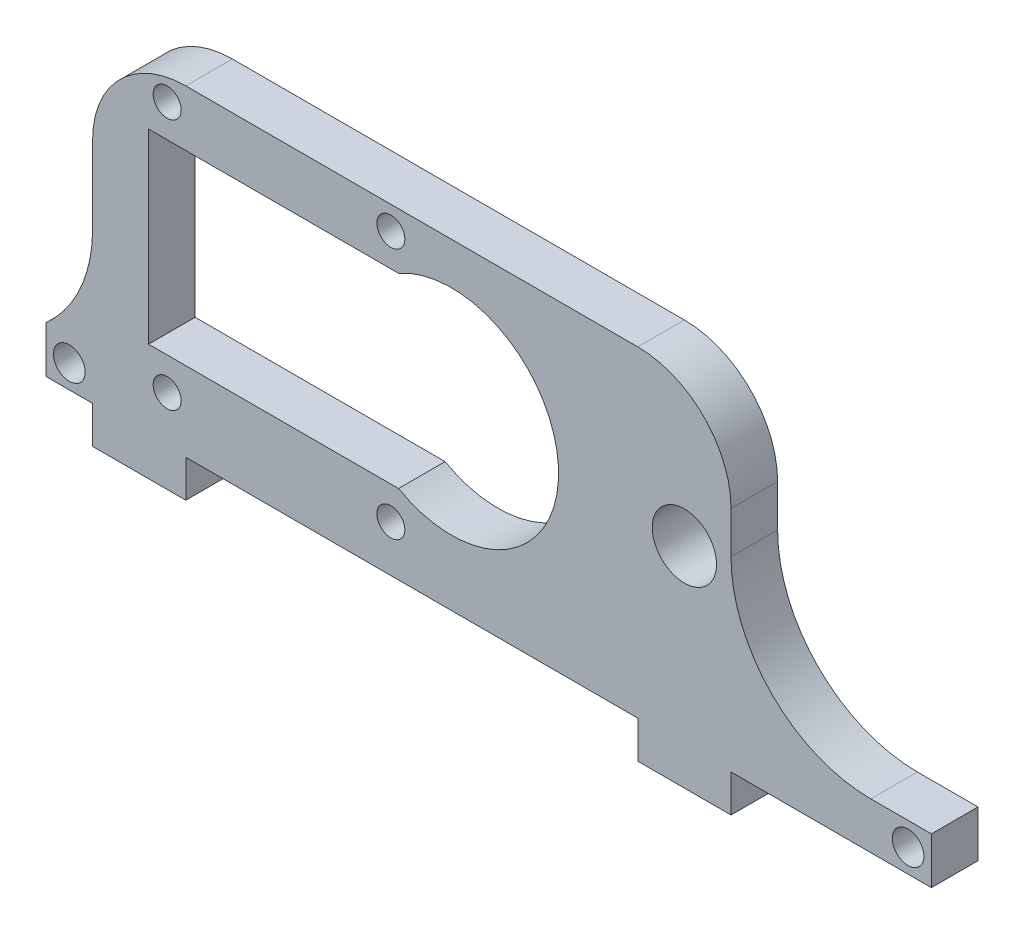
from build123d import *

# Parameters (mm, degrees)
SKETCH1_R          = 3.45
SKETCH1_R_2        = 1.5
SKETCH1_R_3        = 1.7
BASE_FLANGE1_DEPTH = 5
FILLET1_R          = 15
FILLET2_R          = 15


# Sheet-metal steps are written as plain solids
with BuildPart() as part:
    # Sketch1 → Base-Flange1 (new body)
    with BuildSketch(Plane.XY):
        with BuildLine():
            Line((-28.5, 16), (20, 16))
            ThreePointArc((20, 16), (27.071067812, 13.071067812), (30, 6))
            Line((30, 6), (30, -13.5))
            Line((30, -13.5), (51.5, -13.5))
            Line((51.5, -13.5), (51.5, -18.5))
            Line((51.5, -18.5), (30, -18.5))
            Line((30, -18.5), (30, -22.5))
            Line((30, -22.5), (20, -22.5))
            Line((20, -22.5), (20, -18.5))
            Line((20, -18.5), (-28.5, -18.5))
            Line((-28.5, -18.5), (-28.5, -22.5))
            Line((-28.5, -22.5), (-38.5, -22.5))
            Line((-38.5, -22.5), (-38.5, -18.5))
            Line((-38.5, -18.5), (-43.5, -18.5))
            Line((-43.5, -18.5), (-43.5, -13.5))
            Line((-43.5, -13.5), (-38.5, -13.5))
            Line((-38.5, -13.5), (-38.5, 6))
            ThreePointArc((-38.5, 6), (-35.571067812, 13.071067812), (-28.5, 16))
        make_face()
        with Locations((25, 0)):
            Circle(SKETCH1_R, mode=Mode.SUBTRACT)
        with Locations((-6.5, 13.5)):
            Circle(SKETCH1_R_2, mode=Mode.SUBTRACT)
        with Locations((-30.5, 13.5)):
            Circle(SKETCH1_R_2, mode=Mode.SUBTRACT)
        with Locations((-30.5, -13.5)):
            Circle(SKETCH1_R_2, mode=Mode.SUBTRACT)
        with Locations((-6.5, -13.5)):
            Circle(SKETCH1_R_2, mode=Mode.SUBTRACT)
        with Locations((-41, -16)):
            Circle(SKETCH1_R_3, mode=Mode.SUBTRACT)
        with Locations((49, -16)):
            Circle(SKETCH1_R_3, mode=Mode.SUBTRACT)
        with BuildLine():
            Line((-5.678908346, 10), (-32.5, 10))
            Line((-32.5, 10), (-32.5, -10))
            Line((-32.5, -10), (-5.678908346, -10))
            ThreePointArc((-5.678908346, -10), (11.5, 0), (-5.678908346, 10))
        make_face(mode=Mode.SUBTRACT)
    extrude(amount=-BASE_FLANGE1_DEPTH)

    # Fillet1
    fillet1_edges = [part.edges().sort_by_distance(p)[0] for p in [
        (30, -13.5, -2.5),
    ]]
    fillet(fillet1_edges, radius=FILLET1_R)

    # Fillet2
    # the kernel refuses this fillet: 15 mm, written as the material it adds along each edge
    with BuildSketch(Plane(origin=(-38.5, -13.5, 0), x_dir=(0, 1, 0), z_dir=(0, 0, -1))) as fillet2_piece_1:
        with BuildLine():
            CenterArc((11.180339887, -15), FILLET2_R, 90, 48.189685104)
            Line((0, -5), (-0.223606798, -4.8))
            ThreePointArc((-0.223606798, -4.8), (-0.3, -2.5), (-0.3, 0))
            Line((-0.3, 0), (0, 0.3))
            Line((0, 0.3), (11.180339887, 0.3))
            Line((11.180339887, 0.3), (11.180339887, 0))
        make_face()
    extrude(amount=5)


solid = part.part
